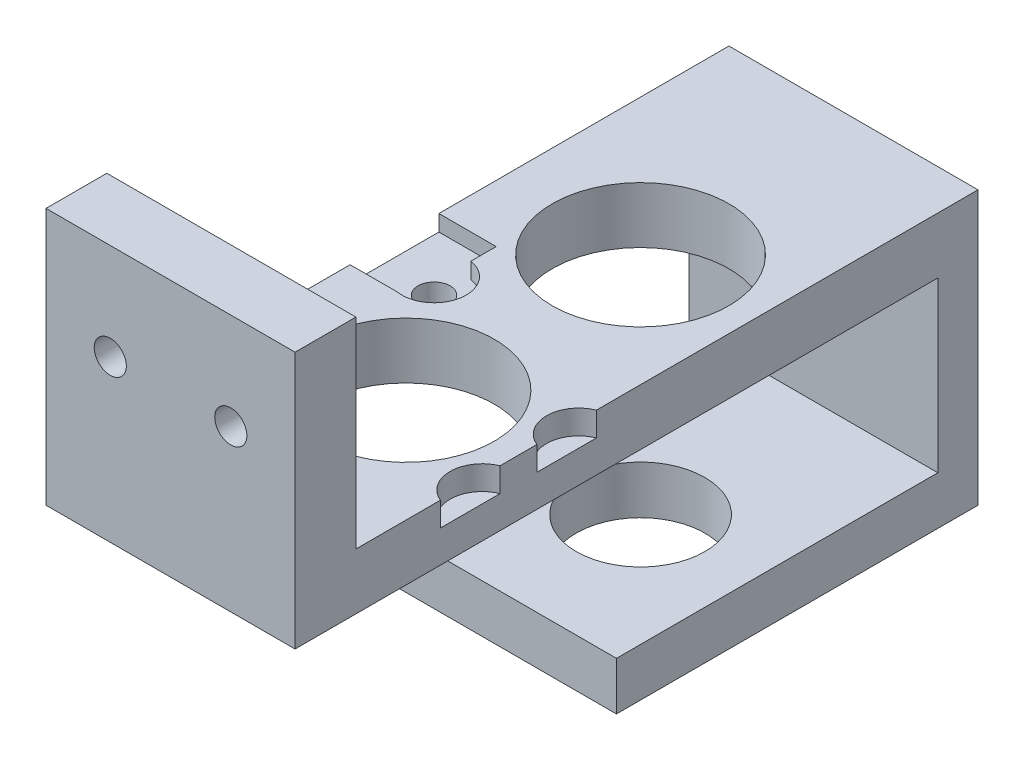
from build123d import *

# Parameters (mm, degrees)
SKETCH1_W           = 31
SKETCH1_H           = 85
BOSS_EXTRUDE1_DEPTH = 7
SKETCH2_R           = 11
CUT_EXTRUDE1_DEPTH  = 100
SKETCH3_R           = 11
CUT_EXTRUDE2_DEPTH  = 7
SKETCH4_W           = 31
SKETCH4_H           = 7.57
BOSS_EXTRUDE3_DEPTH = 25
SKETCH5_R           = 2
CUT_EXTRUDE3_DEPTH  = 14
SKETCH6_R           = 2
CUT_EXTRUDE4_DEPTH  = 14
SKETCH10_W          = 31
SKETCH10_H          = 5
BOSS_EXTRUDE4_DEPTH = 27
SKETCH11_W          = 31
SKETCH11_H          = 6
BOSS_EXTRUDE5_DEPTH = 40
SKETCH9_R           = 8
CUT_EXTRUDE5_DEPTH  = 40
SKETCH13_R          = 4
CUT_EXTRUDE6_DEPTH  = 2
SKETCH15_W          = 7.132198052
SKETCH15_H          = 11.047195358
SKETCH15_W_2        = 7.735251328
SKETCH15_H_2        = 9.356853031
CUT_EXTRUDE9_DEPTH  = 2
CUT_EXTRUDE10_DEPTH = 3


with BuildPart() as part:
    # Sketch1 → Boss-Extrude1 (new body)
    with BuildSketch(Plane(origin=(0, 0, 0), x_dir=(1, 0, 0), z_dir=(0, 1, 0))):
        with Locations((-34.66194332, -13.734817814)):
            Rectangle(SKETCH1_W, SKETCH1_H)
    extrude(amount=BOSS_EXTRUDE1_DEPTH)

    # Sketch2 → Cut-Extrude1 (cut)
    with BuildSketch(Plane(origin=(0, 7, 0), x_dir=(1, 0, 0), z_dir=(0, 1, 0))):
        with Locations((-33.16194332, 0.765182186)):
            Circle(SKETCH2_R)
    extrude(amount=-CUT_EXTRUDE1_DEPTH, mode=Mode.SUBTRACT)

    # Sketch3 → Cut-Extrude2 (cut)
    with BuildSketch(Plane(origin=(0, 7, 0), x_dir=(1, 0, 0), z_dir=(0, 1, 0))):
        with Locations((-33.16194332, -28.434817814)):
            Circle(SKETCH3_R)
    extrude(amount=-CUT_EXTRUDE2_DEPTH, mode=Mode.SUBTRACT)

    # Sketch4 → Boss-Extrude3 (add)
    with BuildSketch(Plane(origin=(0, 7, 0), x_dir=(1, 0, 0), z_dir=(0, 1, 0))):
        with Locations((-34.66194332, -52.449817814)):
            Rectangle(SKETCH4_W, SKETCH4_H)
    extrude(amount=BOSS_EXTRUDE3_DEPTH)

    # Sketch5 → Cut-Extrude3 (cut)
    with BuildSketch(Plane(origin=(0, 0, 48.664817814), x_dir=(-1, 0, 0), z_dir=(0, 0, -1))):
        with Locations((42.16194332, 20)):
            Circle(SKETCH5_R)
        with Locations((27.16194332, 20)):
            Circle(SKETCH5_R)
    extrude(amount=-CUT_EXTRUDE3_DEPTH, mode=Mode.SUBTRACT)

    # Sketch6 → Cut-Extrude4 (cut)
    with BuildSketch(Plane(origin=(0, 7, 0), x_dir=(1, 0, 0), z_dir=(0, 1, 0))):
        with Locations((-43.66194332, -14.434817814)):
            Circle(SKETCH6_R)
        with Locations((-43.66194332, -42.434817814)):
            Circle(SKETCH6_R)
    extrude(amount=-CUT_EXTRUDE4_DEPTH, mode=Mode.SUBTRACT)

    # Sketch10 → Boss-Extrude4 (add)
    with BuildSketch(Plane.XZ):
        with Locations((-34.66194332, -26.265182186)):
            Rectangle(SKETCH10_W, SKETCH10_H)
    extrude(amount=BOSS_EXTRUDE4_DEPTH)

    # Sketch11 → Boss-Extrude5 (add)
    with BuildSketch(Plane.XY.offset(-23.765182186)):
        with Locations((-34.66194332, -24)):
            Rectangle(SKETCH11_W, SKETCH11_H)
    extrude(amount=BOSS_EXTRUDE5_DEPTH)

    # Sketch9 → Cut-Extrude5 (cut)
    with BuildSketch(Plane(origin=(0, 7, 0), x_dir=(1, 0, 0), z_dir=(0, 1, 0))):
        with Locations((-33.16194332, 0.765182186)):
            Circle(SKETCH9_R)
    extrude(amount=-CUT_EXTRUDE5_DEPTH, mode=Mode.SUBTRACT)

    # Sketch13 → Cut-Extrude6 (cut)
    with BuildSketch(Plane(origin=(0, 7, 0), x_dir=(1, 0, 0), z_dir=(0, 1, 0))):
        with Locations((-43.66194332, -14.434817814)):
            Circle(SKETCH13_R)
        with Locations((-43.66194332, -42.434817814)):
            Circle(SKETCH13_R)
    extrude(amount=-CUT_EXTRUDE6_DEPTH, mode=Mode.SUBTRACT)

    # Sketch15 → Cut-Extrude9 (cut)
    with BuildSketch(Plane(origin=(0, 7, 0), x_dir=(1, 0, 0), z_dir=(0, 1, 0))):
        with Locations((-46.595844294, -12.860944888)):
            Rectangle(SKETCH15_W, SKETCH15_H)
        with Locations((-46.294317656, -43.986391299)):
            Rectangle(SKETCH15_W_2, SKETCH15_H_2)
    extrude(amount=-CUT_EXTRUDE9_DEPTH, mode=Mode.SUBTRACT)

    # Sketch17 → Cut-Extrude10 (cut)
    with BuildSketch(Plane(origin=(0, 7, 0), x_dir=(1, 0, 0), z_dir=(0, 1, 0))):
        with BuildLine():
            ThreePointArc((-19.16194332, -18.72671857), (-21.66194332, -22.434817814), (-19.16194332, -26.142917057))
            Line((-19.16194332, -26.142917057), (-19.16194332, -18.72671857))
        make_face()
        with BuildLine():
            Line((-19.16194332, -38.142917057), (-19.16194332, -30.72671857))
            ThreePointArc((-19.16194332, -30.72671857), (-21.66194332, -34.434817814), (-19.16194332, -38.142917057))
        make_face()
    extrude(amount=-CUT_EXTRUDE10_DEPTH, mode=Mode.SUBTRACT)


solid = part.part
